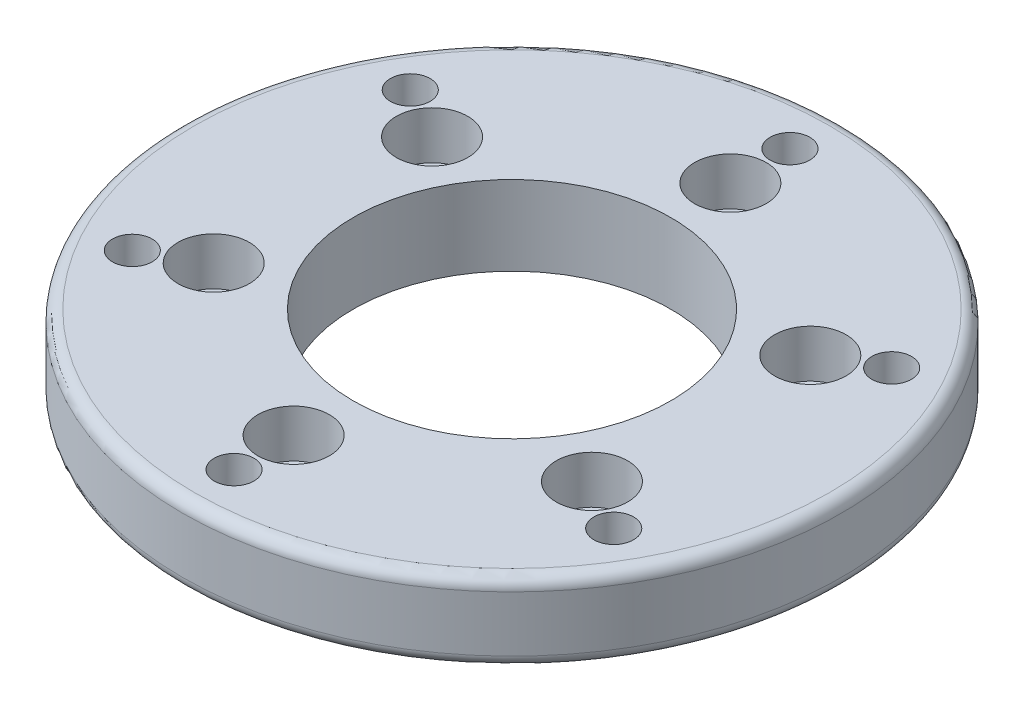
from build123d import *

# Parameters (mm, degrees)
SKETCH1_R                     = 41.5
MAIN_PLATE_DEPTH              = 10
SKETCH2_R                     = 2.05
CUT_EXTRUDE_G27_DEPTH         = 60.535703574
SKETCH5_R                     = 4.5
G27_SCREW_HEADS_DEPTH         = 6
SKETCH3_R                     = 2.5
MOMO_SPARKO_DEPTH             = 60.535703574
SKETCH6_R                     = 4.75
MOMO_SPARKO_SCREW_HEADS_DEPTH = 3
SKETCH4_R                     = 20
CENTER_HOLE_DEPTH             = 60.535703574
FILLET1_R                     = 1.5
FILLET2_R                     = 1.5


with BuildPart() as part:
    # Sketch1 → Main Plate (new body)
    with BuildSketch(Plane(origin=(0, 0, 0), x_dir=(1, 0, 0), z_dir=(0, 1, 0))):
        Circle(SKETCH1_R)
    extrude(amount=MAIN_PLATE_DEPTH)

    # Sketch2 → Cut-Extrude G27 (cut, through all)
    with BuildSketch(Plane(origin=(0, 10, 0), x_dir=(1, 0, 0), z_dir=(0, 1, 0))):
        with Locations((0, 27.5)):
            Circle(SKETCH2_R)
        with Locations((23.815698604, 13.75)):
            Circle(SKETCH2_R)
        with Locations((23.815698604, -13.75)):
            Circle(SKETCH2_R)
        with Locations((0, -27.5)):
            Circle(SKETCH2_R)
        with Locations((-23.815698604, -13.75)):
            Circle(SKETCH2_R)
        with Locations((-23.815698604, 13.75)):
            Circle(SKETCH2_R)
    extrude(amount=-CUT_EXTRUDE_G27_DEPTH, mode=Mode.SUBTRACT)

    # Sketch5 → G27 Screw Heads (cut)
    with BuildSketch(Plane(origin=(0, 10, 0), x_dir=(1, 0, 0), z_dir=(0, 1, 0))):
        with Locations((0, 27.5)):
            Circle(SKETCH5_R)
        with Locations((23.815698604, 13.75)):
            Circle(SKETCH5_R)
        with Locations((23.815698604, -13.75)):
            Circle(SKETCH5_R)
        with Locations((0, -27.5)):
            Circle(SKETCH5_R)
        with Locations((-23.815698604, -13.75)):
            Circle(SKETCH5_R)
        with Locations((-23.815698604, 13.75)):
            Circle(SKETCH5_R)
    extrude(amount=-G27_SCREW_HEADS_DEPTH, mode=Mode.SUBTRACT)

    # Sketch3 → Momo - Sparko (cut, through all)
    with BuildSketch(Plane(origin=(0, 10, 0), x_dir=(1, 0, 0), z_dir=(0, 1, 0))):
        with Locations((0, 35)):
            Circle(SKETCH3_R)
        with Locations((30.310889132, 17.5)):
            Circle(SKETCH3_R)
        with Locations((30.310889132, -17.5)):
            Circle(SKETCH3_R)
        with Locations((0, -35)):
            Circle(SKETCH3_R)
        with Locations((-30.310889132, -17.5)):
            Circle(SKETCH3_R)
        with Locations((-30.310889132, 17.5)):
            Circle(SKETCH3_R)
    extrude(amount=-MOMO_SPARKO_DEPTH, mode=Mode.SUBTRACT)

    # Sketch6 → Momo - Sparko Screw Heads (cut)
    with BuildSketch(Plane.XZ):
        with Locations((0, 35)):
            Circle(SKETCH6_R)
        with Locations((30.310889132, 17.5)):
            Circle(SKETCH6_R)
        with Locations((30.310889132, -17.5)):
            Circle(SKETCH6_R)
        with Locations((0, -35)):
            Circle(SKETCH6_R)
        with Locations((-30.310889132, -17.5)):
            Circle(SKETCH6_R)
        with Locations((-30.310889132, 17.5)):
            Circle(SKETCH6_R)
    extrude(amount=-MOMO_SPARKO_SCREW_HEADS_DEPTH, mode=Mode.SUBTRACT)

    # Sketch4 → Center Hole (cut, through all)
    with BuildSketch(Plane(origin=(0, 10, 0), x_dir=(1, 0, 0), z_dir=(0, 1, 0))):
        Circle(SKETCH4_R)
    extrude(amount=-CENTER_HOLE_DEPTH, mode=Mode.SUBTRACT)

    # Fillet1
    fillet1_edges = [part.edges().sort_by_distance(p)[0] for p in [
        (-41.5, 10, 0),
    ]]
    fillet(fillet1_edges, radius=FILLET1_R)

    # Fillet2
    fillet2_edges = [part.edges().sort_by_distance(p)[0] for p in [
        (-41.5, 0, 0),
    ]]
    fillet(fillet2_edges, radius=FILLET2_R)


solid = part.part
